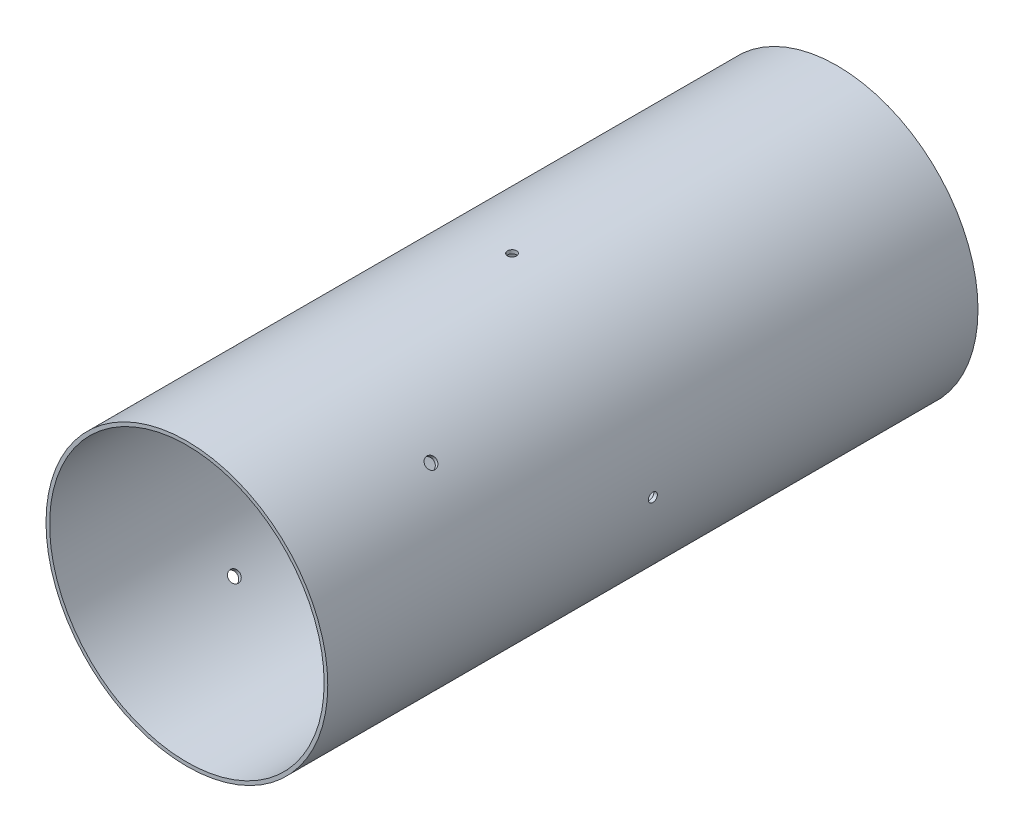
from build123d import *

# Parameters (mm, degrees)
SKETCH1_R           = 49.53
SKETCH1_R_2         = 48.26
BOSS_EXTRUDE1_DEPTH = 228.6
SKETCH2_R           = 1.984375
CUT_EXTRUDE1_DEPTH  = 12.7
CIRPATTERN1_COUNT   = 4
SKETCH3_R           = 2.38125
CUT_EXTRUDE2_DEPTH  = 25.4
SKETCH4_R           = 1.5875
CUT_EXTRUDE3_DEPTH  = 37.338
CIRPATTERN2_COUNT   = 4


with BuildPart() as part:
    # Sketch1 → Boss-Extrude1 (new body)
    with BuildSketch(Plane.XY):
        Circle(SKETCH1_R)
        Circle(SKETCH1_R_2, mode=Mode.SUBTRACT)
    extrude(amount=BOSS_EXTRUDE1_DEPTH)

    # Sketch2 → Cut-Extrude1 (cut)
    with BuildSketch(Plane(origin=(-120.58027232, -48.738223352, -78.995371644), x_dir=(0.7071067811865487, 0.7071067811865465, 0), z_dir=(-0.7071067811865465, 0.7071067811865487, 0))):
        with Locations((119.72625647, -256.795371644)):
            Circle(SKETCH2_R)
    cut_extrude1 = extrude(amount=-CUT_EXTRUDE1_DEPTH, mode=Mode.SUBTRACT)

    # CirPattern1: Cut-Extrude1 ×4 about axis
    cirpattern1_axis = Axis((0, 0, 0), (0, 0, -1))
    for i in range(1, CIRPATTERN1_COUNT):
        add(cut_extrude1.rotate(cirpattern1_axis, i * 360 / CIRPATTERN1_COUNT), mode=Mode.SUBTRACT)

    # Sketch3 → Cut-Extrude2 (cut)
    with BuildSketch(Plane(origin=(-108.021767186, -85.49918909, -79.333156205), x_dir=(0, 0, 1), z_dir=(-0.8660254037844379, 0.5000000000000014, 0))):
        with Locations((196.808156205, 128.055353348)):
            Circle(SKETCH3_R)
        with Locations((190.458156205, 128.055353348)):
            Circle(SKETCH3_R)
    extrude(amount=-CUT_EXTRUDE2_DEPTH, mode=Mode.SUBTRACT)

    # Sketch4 → Cut-Extrude3 (cut)
    with BuildSketch(Plane(origin=(-33.663219436, -130.56478129, -80.778194099), x_dir=(0, 0, -1), z_dir=(1, 0, 0))):
        with Locations((-195.078194099, 130.56478129)):
            Circle(SKETCH4_R)
    cut_extrude3 = extrude(amount=-CUT_EXTRUDE3_DEPTH, mode=Mode.SUBTRACT)

    # CirPattern2: Cut-Extrude3 ×4 about axis
    cirpattern2_axis = Axis((0, 0, 228.6), (0, 0, -1))
    for i in range(1, CIRPATTERN2_COUNT):
        add(cut_extrude3.rotate(cirpattern2_axis, i * 360 / CIRPATTERN2_COUNT), mode=Mode.SUBTRACT)


solid = part.part
